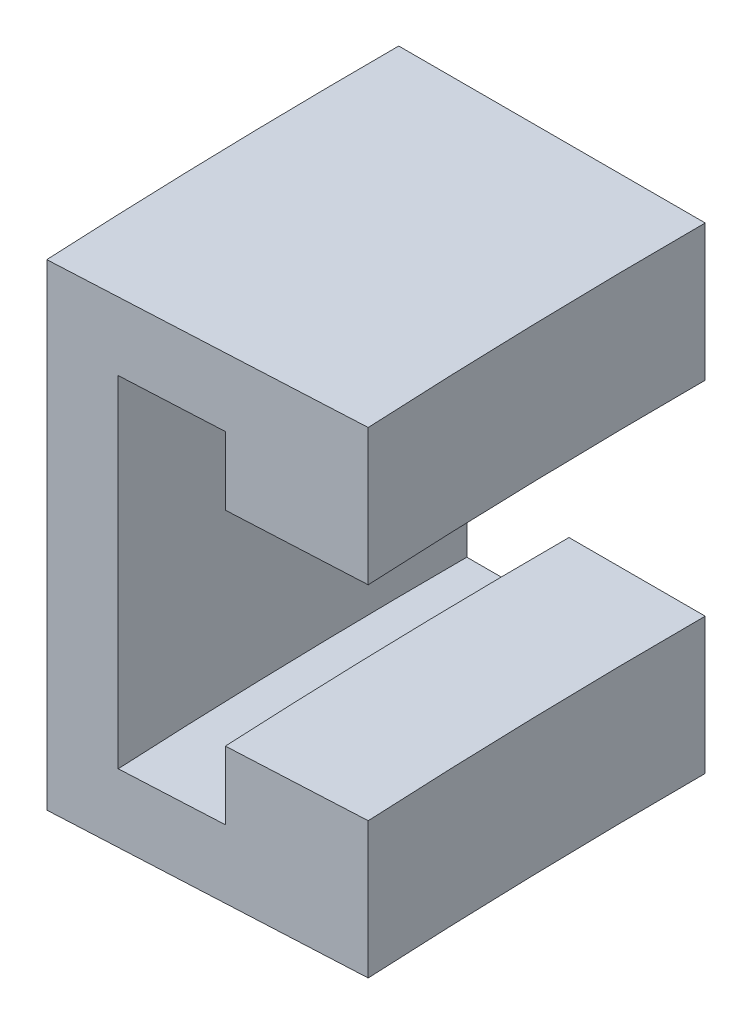
from build123d import *


with BuildPart() as part:
    # Sweep1: sweep along a path in Sketch3
    with BuildLine(Plane(origin=(0, 0, 0), x_dir=(1, 0, 0), z_dir=(0, 1, 0))) as sweep1_path:
        ThreePointArc((50, 0), (50.312744462, -25.007821058), (51.250782228, -50))
    # Sketch1<2> → Sweep1 (sweep)
    with BuildSketch(Plane.XY):
        Polygon((0, 25), (0, -25), (15, -25), (15, -15), (35, -15), (35, -35), (-10, -35), (-10, 35), (35, 35), (35, 15), (15, 15), (15, 25), align=None)
    sweep(path=sweep1_path.line)


solid = part.part
